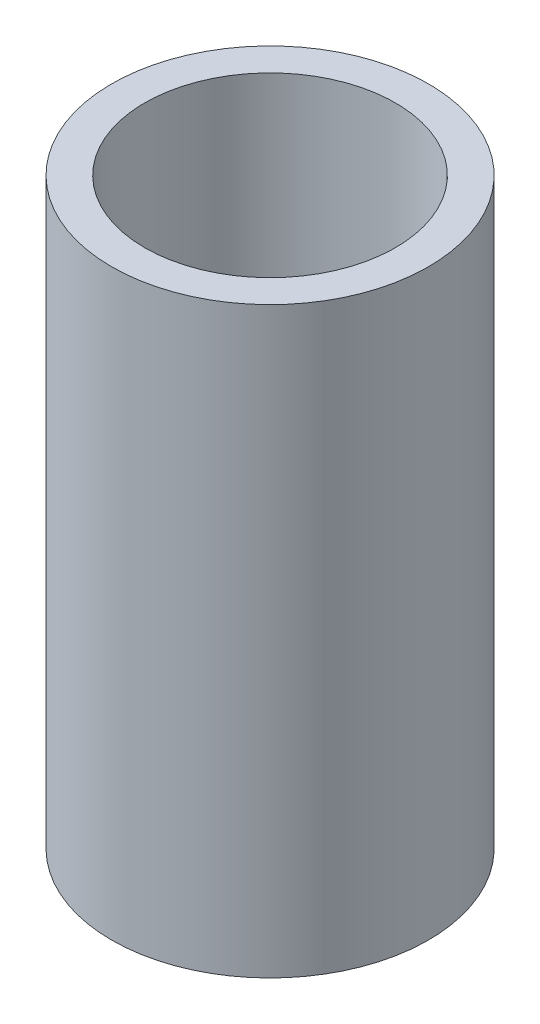
from build123d import *

# Parameters (mm, degrees)
SKETCH1_R           = 20
BOSS_EXTRUDE1_DEPTH = 73.61574135
SKETCH2_R           = 15.832865493
CUT_EXTRUDE1_DEPTH  = 79.862395186


with BuildPart() as part:
    # Sketch1 → Boss-Extrude1 (new body)
    with BuildSketch(Plane(origin=(0, 0, 0), x_dir=(1, 0, 0), z_dir=(0, 1, 0))):
        Circle(SKETCH1_R)
    extrude(amount=BOSS_EXTRUDE1_DEPTH)

    # Sketch2 → Cut-Extrude1 (cut, through all)
    with BuildSketch(Plane(origin=(0, 0, 0), x_dir=(1, 0, 0), z_dir=(0, 1, 0))):
        Circle(SKETCH2_R)
    extrude(amount=CUT_EXTRUDE1_DEPTH, mode=Mode.SUBTRACT)


solid = part.part
